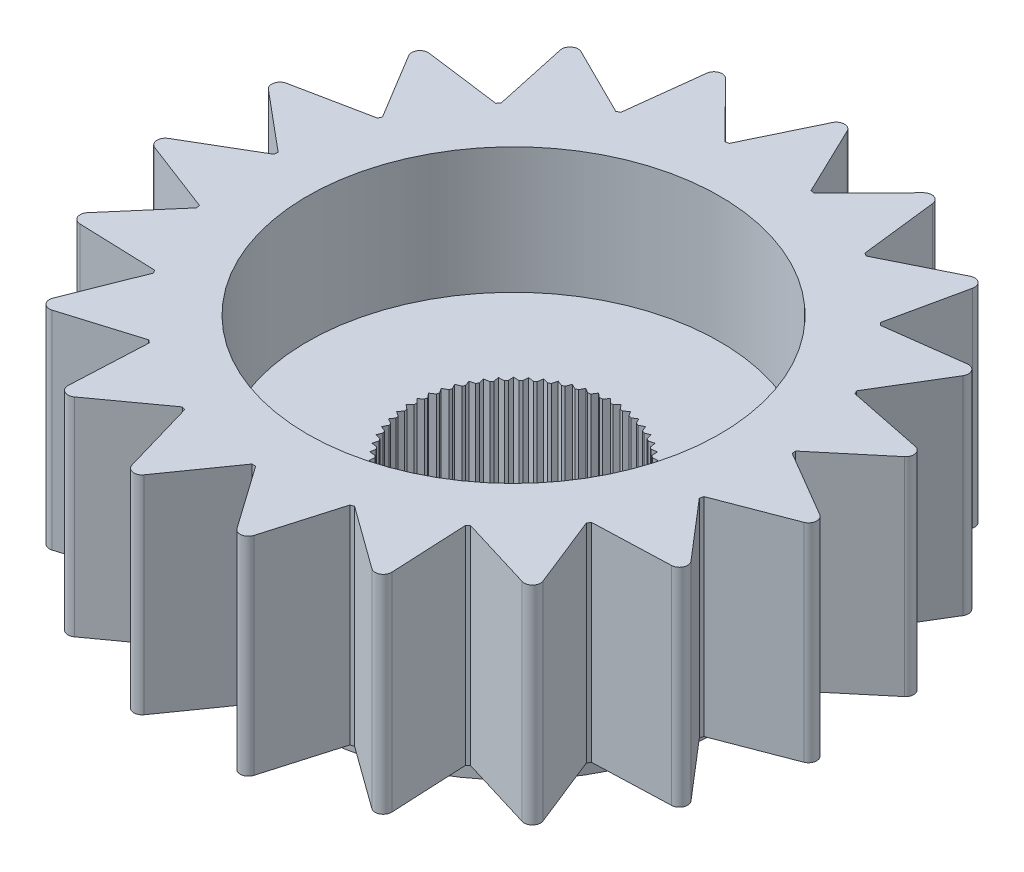
from build123d import *

# Parameters (mm, degrees)
SKETCH1_R                = 5.039999953
BOSS_EXTRUDE3_DEPTH      = 3.2
BOSS_EXTRUDE4_DEPTH      = 3.08
BOSS_EXTRUDE4_DEPTH_BACK = 2
SKETCH7_R                = 5.039999953
CUT_EXTRUDE2_DEPTH       = 14.847814094
FILLET1_R                = 0.2


with BuildPart() as part:
    # Sketch1 → Boss-Extrude3 (new body)
    with BuildSketch(Plane(origin=(0, 0, 0), x_dir=(1, 0, 0), z_dir=(0, 1, 0))):
        with Locations(Location((0.260092078, 0.520184157, 0), (0, 0, 270))):
            Circle(SKETCH1_R)
    extrude(amount=BOSS_EXTRUDE3_DEPTH)

    # Sketch7 → Boss-Extrude4 (add, two sides: drawn at the far end of the back side and taken through both)
    with BuildSketch(Plane(origin=(0, 3.2, 0), x_dir=(1, 0, 0), z_dir=(0, 1, 0)).offset(-BOSS_EXTRUDE4_DEPTH_BACK)):
        with BuildLine():
            Line((1.260092078, 6.79094966), (0.260092078, 8.870184157))
            Line((0.260092078, 8.870184157), (-0.739907922, 6.79094966))
            ThreePointArc((-0.739907922, 6.79094966), (-0.78508357, 6.783578433), (-0.83020491, 6.775881758))
            Line((-0.83020491, 6.775881758), (-2.451148489, 8.417758125))
            Line((-2.451148489, 8.417758125), (-2.721839394, 6.12648282))
            ThreePointArc((-2.721839394, 6.12648282), (-2.762173867, 6.104842477), (-2.802351303, 6.082911953))
            Line((-2.802351303, 6.082911953), (-4.868584073, 7.10950741))
            Line((-4.868584073, 7.10950741), (-4.380632322, 4.854486528))
            ThreePointArc((-4.380632322, 4.854486528), (-4.411754754, 4.820922137), (-4.442634436, 4.787134277))
            Line((-4.442634436, 4.787134277), (-6.730248015, 5.087201277))
            Line((-6.730248015, 5.087201277), (-5.536530752, 3.112801321))
            ThreePointArc((-5.536530752, 3.112801321), (-5.555068546, 3.070950103), (-5.573304181, 3.028966347))
            Line((-5.573304181, 3.028966347), (-7.834400142, 2.569987974))
            Line((-7.834400142, 2.569987974), (-6.064275155, 1.090165815))
            ThreePointArc((-6.064275155, 1.090165815), (-6.068219452, 1.044563001), (-6.071834927, 0.998932939))
            Line((-6.071834927, 0.998932939), (-8.061388438, -0.169353378))
            Line((-8.061388438, -0.169353378), (-5.906676236, -0.994236047))
            ThreePointArc((-5.906676236, -0.994236047), (-5.89559961, -1.038648686), (-5.884203132, -1.082980328))
            Line((-5.884203132, -1.082980328), (-7.386615199, -2.833972639))
            Line((-7.386615199, -2.833972639), (-5.080812283, -2.914526982))
            ThreePointArc((-5.080812283, -2.914526982), (-5.055915059, -2.952936647), (-5.030741612, -2.991165848))
            Line((-5.030741612, -2.991165848), (-5.883202576, -5.135116966))
            Line((-5.883202576, -5.135116966), (-3.676178469, -4.462613669))
            ThreePointArc((-3.676178469, -4.462613669), (-3.640158647, -4.490858078), (-3.603936167, -4.51884211))
            Line((-3.603936167, -4.51884211), (-3.714068653, -6.823421666))
            Line((-3.714068653, -6.823421666), (-1.844988664, -5.470736896))
            ThreePointArc((-1.844988664, -5.470736896), (-1.801749551, -5.485755328), (-1.758403304, -5.500461688))
            Line((-1.758403304, -5.500461688), (-1.11427275, -7.715932727))
            Line((-1.11427275, -7.715932727), (0.214319303, -5.829650869))
            ThreePointArc((0.214319303, -5.829650869), (0.260092078, -5.829815843), (0.305864854, -5.829650869))
            Line((0.305864854, -5.829650869), (1.634456907, -7.715932727))
            Line((1.634456907, -7.715932727), (2.278587461, -5.500461688))
            ThreePointArc((2.278587461, -5.500461688), (2.321933708, -5.485755328), (2.365172821, -5.470736896))
            Line((2.365172821, -5.470736896), (4.23425281, -6.823421666))
            Line((4.23425281, -6.823421666), (4.124120323, -4.51884211))
            ThreePointArc((4.124120323, -4.51884211), (4.160342804, -4.490858078), (4.196362626, -4.462613669))
            Line((4.196362626, -4.462613669), (6.403386733, -5.135116966))
            Line((6.403386733, -5.135116966), (5.550925769, -2.991165848))
            ThreePointArc((5.550925769, -2.991165848), (5.576099215, -2.952936647), (5.60099644, -2.914526982))
            Line((5.60099644, -2.914526982), (7.906799356, -2.833972639))
            Line((7.906799356, -2.833972639), (6.404387289, -1.082980328))
            ThreePointArc((6.404387289, -1.082980328), (6.415783767, -1.038648686), (6.426860393, -0.994236047))
            Line((6.426860393, -0.994236047), (8.581572595, -0.169353378))
            Line((8.581572595, -0.169353378), (6.592019084, 0.998932939))
            ThreePointArc((6.592019084, 0.998932939), (6.588403609, 1.044563001), (6.584459312, 1.090165815))
            Line((6.584459312, 1.090165815), (8.354584299, 2.569987974))
            Line((8.354584299, 2.569987974), (6.093488338, 3.028966347))
            ThreePointArc((6.093488338, 3.028966347), (6.075252703, 3.070950103), (6.056714909, 3.112801321))
            Line((6.056714909, 3.112801321), (7.250432172, 5.087201277))
            Line((7.250432172, 5.087201277), (4.962818593, 4.787134277))
            ThreePointArc((4.962818593, 4.787134277), (4.931938911, 4.820922137), (4.900816478, 4.854486528))
            Line((4.900816478, 4.854486528), (5.388768229, 7.10950741))
            Line((5.388768229, 7.10950741), (3.32253546, 6.082911953))
            ThreePointArc((3.32253546, 6.082911953), (3.282358024, 6.104842477), (3.242023551, 6.12648282))
            Line((3.242023551, 6.12648282), (2.971332646, 8.417758125))
            Line((2.971332646, 8.417758125), (1.350389067, 6.775881758))
            ThreePointArc((1.350389067, 6.775881758), (1.305267727, 6.783578433), (1.260092078, 6.79094966))
        make_face()
        with Locations(Location((0.260092078, 0.520184157, 0), (0, 0, 270))):
            Circle(SKETCH7_R, mode=Mode.SUBTRACT)
    extrude(amount=BOSS_EXTRUDE4_DEPTH + BOSS_EXTRUDE4_DEPTH_BACK)

    # Sketch1<6> → Cut-Extrude2 (cut, through all)
    with BuildSketch(Plane(origin=(0, 0, 0), x_dir=(1, 0, 0), z_dir=(0, 1, 0))):
        Polygon((0.294358132, 2.920184112), (0.225826025, 2.920184112), (0.12925219, 3.016757947), (0.043302111, 2.910618439), (-0.024854569, 2.903454883), (-0.130994077, 2.989404962), (-0.205378713, 2.874862668), (-0.272413228, 2.860614041), (-0.386955522, 2.934998677), (-0.448959741, 2.813308546), (-0.514137647, 2.79213096), (-0.635827779, 2.854135179), (-0.684772249, 2.726630473), (-0.747379444, 2.698755955), (-0.87488415, 2.747700425), (-0.910232627, 2.615778113), (-0.969583171, 2.58151206), (-1.101505484, 2.616860537), (-1.122870681, 2.481965988), (-1.17831432, 2.441683826), (-1.31320887, 2.463049024), (-1.320356707, 2.326660169), (-1.371285987, 2.28080324), (-1.507674841, 2.287951077), (-1.500527004, 2.151562222), (-1.546383934, 2.100632942), (-1.682772789, 2.093485105), (-1.661407591, 1.958590555), (-1.701689752, 1.903146917), (-1.836584302, 1.881781719), (-1.801235825, 1.749859407), (-1.835501878, 1.690508862), (-1.96742419, 1.655160385), (-1.918479719, 1.527655679), (-1.946354238, 1.465048485), (-2.073858944, 1.416104014), (-2.011854725, 1.294413882), (-2.03303231, 1.229235976), (-2.154722442, 1.167231757), (-2.080337806, 1.052689463), (-2.094586432, 0.985654948), (-2.209128727, 0.911270312), (-2.123178648, 0.805130804), (-2.130342203, 0.736974124), (-2.236481712, 0.651024045), (-2.139907876, 0.55445021), (-2.139907876, 0.485918104), (-2.236481712, 0.389344269), (-2.130342203, 0.30339419), (-2.123178648, 0.23523751), (-2.209128727, 0.129098002), (-2.094586432, 0.054713366), (-2.080337806, -0.012321149), (-2.154722442, -0.126863444), (-2.03303231, -0.188867663), (-2.011854725, -0.254045569), (-2.073858944, -0.3757357), (-1.946354238, -0.424680171), (-1.918479719, -0.487287365), (-1.96742419, -0.614792071), (-1.835501878, -0.650140548), (-1.801235825, -0.709491093), (-1.836584302, -0.841413405), (-1.701689752, -0.862778603), (-1.661407591, -0.918222241), (-1.682772789, -1.053116791), (-1.546383934, -1.060264628), (-1.500527004, -1.111193908), (-1.507674841, -1.247582763), (-1.371285987, -1.240434926), (-1.320356707, -1.286291856), (-1.31320887, -1.42268071), (-1.17831432, -1.401315512), (-1.122870681, -1.441597674), (-1.101505484, -1.576492224), (-0.969583171, -1.541143747), (-0.910232627, -1.5754098), (-0.87488415, -1.707332112), (-0.747379444, -1.658387641), (-0.684772249, -1.68626216), (-0.635827779, -1.813766866), (-0.514137647, -1.751762647), (-0.448959741, -1.772940232), (-0.386955522, -1.894630363), (-0.272413228, -1.820245728), (-0.205378713, -1.834494354), (-0.130994077, -1.949036648), (-0.024854569, -1.863086569), (0.043302111, -1.870250125), (0.12925219, -1.976389633), (0.225826025, -1.879815798), (0.294358132, -1.879815798), (0.390931967, -1.976389633), (0.476882046, -1.870250125), (0.545038726, -1.863086569), (0.651178234, -1.949036648), (0.725562869, -1.834494354), (0.792597385, -1.820245728), (0.907139679, -1.894630363), (0.969143898, -1.772940232), (1.034321804, -1.751762647), (1.156011935, -1.813766866), (1.204956406, -1.68626216), (1.267563601, -1.658387641), (1.395068306, -1.707332112), (1.430416783, -1.5754098), (1.489767328, -1.541143747), (1.62168964, -1.576492224), (1.643054838, -1.441597674), (1.698498477, -1.401315512), (1.833393026, -1.42268071), (1.840540863, -1.286291856), (1.891470144, -1.240434926), (2.027858998, -1.247582763), (2.020711161, -1.111193908), (2.066568091, -1.060264628), (2.202956946, -1.053116791), (2.181591748, -0.918222241), (2.221873909, -0.862778603), (2.356768459, -0.841413405), (2.321419982, -0.709491093), (2.355686035, -0.650140548), (2.487608347, -0.614792071), (2.438663876, -0.487287365), (2.466538395, -0.424680171), (2.594043101, -0.3757357), (2.532038882, -0.254045569), (2.553216467, -0.188867663), (2.674906599, -0.126863444), (2.600521963, -0.012321149), (2.614770589, 0.054713366), (2.729312883, 0.129098002), (2.643362805, 0.23523751), (2.65052636, 0.30339419), (2.756665868, 0.389344269), (2.660092033, 0.485918104), (2.660092033, 0.55445021), (2.756665868, 0.651024045), (2.65052636, 0.736974124), (2.643362805, 0.805130804), (2.729312883, 0.911270312), (2.614770589, 0.985654948), (2.600521963, 1.052689463), (2.674906599, 1.167231757), (2.553216467, 1.229235976), (2.532038882, 1.294413882), (2.594043101, 1.416104014), (2.466538395, 1.465048485), (2.438663876, 1.527655679), (2.487608347, 1.655160385), (2.355686035, 1.690508862), (2.321419982, 1.749859407), (2.356768459, 1.881781719), (2.221873909, 1.903146917), (2.181591748, 1.958590555), (2.202956946, 2.093485105), (2.066568091, 2.100632942), (2.020711161, 2.151562222), (2.027858998, 2.287951077), (1.891470144, 2.28080324), (1.840540863, 2.326660169), (1.833393026, 2.463049024), (1.698498477, 2.441683826), (1.643054838, 2.481965988), (1.62168964, 2.616860537), (1.489767328, 2.58151206), (1.430416783, 2.615778113), (1.395068306, 2.747700425), (1.267563601, 2.698755955), (1.204956406, 2.726630473), (1.156011935, 2.854135179), (1.034321804, 2.79213096), (0.969143898, 2.813308546), (0.907139679, 2.934998677), (0.792597385, 2.860614041), (0.725562869, 2.874862668), (0.651178234, 2.989404962), (0.545038726, 2.903454883), (0.476882046, 2.910618439), (0.390931967, 3.016757947), align=None)
    extrude(amount=CUT_EXTRUDE2_DEPTH, mode=Mode.SUBTRACT)

    # Fillet1
    fillet1_edges = [part.edges().sort_by_distance(p)[0] for p in [
        (-6.730248015, 3.74, -5.087201277),
        (-4.868584073, 3.74, -7.10950741),
        (-2.451148489, 3.74, -8.417758125),
        (0.260092078, 3.74, -8.870184157),
        (2.971332646, 3.74, -8.417758125),
        (5.388768229, 3.74, -7.10950741),
        (7.250432172, 3.74, -5.087201277),
        (8.354584299, 3.74, -2.569987974),
        (8.581572595, 3.74, 0.169353378),
        (7.906799356, 3.74, 2.833972639),
        (6.403386733, 3.74, 5.135116966),
        (4.23425281, 3.74, 6.823421666),
        (1.634456907, 3.74, 7.715932727),
        (-1.11427275, 3.74, 7.715932727),
        (-3.714068653, 3.74, 6.823421666),
        (-5.883202576, 3.74, 5.135116966),
        (-7.386615199, 3.74, 2.833972639),
        (-8.061388438, 3.74, 0.169353378),
        (-7.834400142, 3.74, -2.569987974),
    ]]
    fillet(fillet1_edges, radius=FILLET1_R)


solid = part.part
